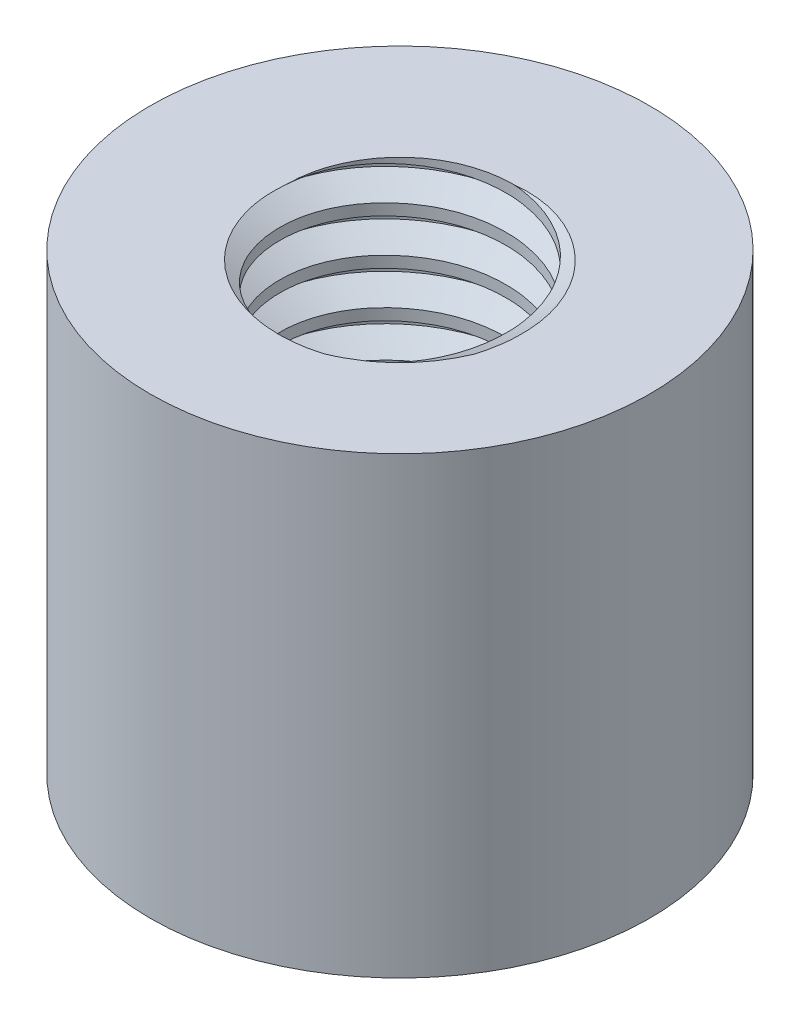
from build123d import *

# Parameters (mm, degrees)
SKETCH1_R             = 2.75
BOSS_EXTRUDE1_DEPTH   = 5
M3X0_5_TAPPED_HOLE1_D = 2.5
THREAD1_PITCH         = 0.5


with BuildPart() as part:
    # Sketch1 → Boss-Extrude1 (new body)
    with BuildSketch(Plane(origin=(0, 0, 0), x_dir=(1, 0, 0), z_dir=(0, 1, 0))):
        with Locations(Location((0, 0, 0), (0, 0, 270))):
            Circle(SKETCH1_R)
    extrude(amount=BOSS_EXTRUDE1_DEPTH)

    # M3x0.5 Tapped Hole1 (through all)
    with Locations(Plane(origin=(0, 5, 0), x_dir=(1, 0, 0), z_dir=(0, 1, 0))):
        with Locations((0, 0)):
            Hole(M3X0_5_TAPPED_HOLE1_D / 2)

    # Thread1: the profile of Thread Profile1 profile screwed along a right-hand helix of 12 turns, 6 arcs to a turn; built about Z, then put on its axis
    thread1_z = Axis((0, 0, 0), (0, 0, 1))
    thread1_corners = [(1.2497, 0, -0.000173205), (1.520632937, 0, 0.156249999), (1.520632937, 0, 0.218749999), (1.2497, 0, 0.375173204)]
    with BuildLine(mode=Mode.PRIVATE) as thread1_profile:
        Line(thread1_corners[0], thread1_corners[1])
        Line(thread1_corners[1], thread1_corners[2])
        Line(thread1_corners[2], thread1_corners[3])
        Line(thread1_corners[3], thread1_corners[0])
    thread1_cap = Face(thread1_profile.wire())
    thread1_turn_angles = [0, 30, 60, 90, 120, 150, 180, 210, 240, 270, 300, 330, 360]
    thread1_turn_weights = [1, 0.8660254037844387, 1, 0.8660254037844387, 1, 0.8660254037844387, 1, 0.8660254037844387, 1, 0.8660254037844387, 1, 0.8660254037844387, 1]
    thread1_turn_rails = [Edge.make_bspline([Vector(p[0], p[1], 0).rotate(thread1_z, thread1_turn_angles[k]) / thread1_turn_weights[k] + Vector(0, 0, p[2] + THREAD1_PITCH * thread1_turn_angles[k] / 360) for k in range(13)], [0, 0, 0, 1, 1, 2, 2, 3, 3, 4, 4, 5, 5, 6, 6, 6], 2, thread1_turn_weights) for p in thread1_corners]
    thread1_turn_sides = [Face.make_surface_from_curves(thread1_turn_rails[p[0]], thread1_turn_rails[p[1]]) for p in [(0, 1), (1, 2), (2, 3), (3, 0)]]
    thread1 = Plane(origin=(0, 6, 0), x_dir=(-1, 0, 0), z_dir=(0, -1, 0)) * Solid(Shell([*[p.moved(Location((0, 0, THREAD1_PITCH * i))) for i in range(12) for p in thread1_turn_sides], thread1_cap, thread1_cap.rotate(thread1_z, 4320).moved(Location((0, 0, THREAD1_PITCH * 4320 / 360)))]))
    add(thread1, mode=Mode.SUBTRACT)


solid = part.part
